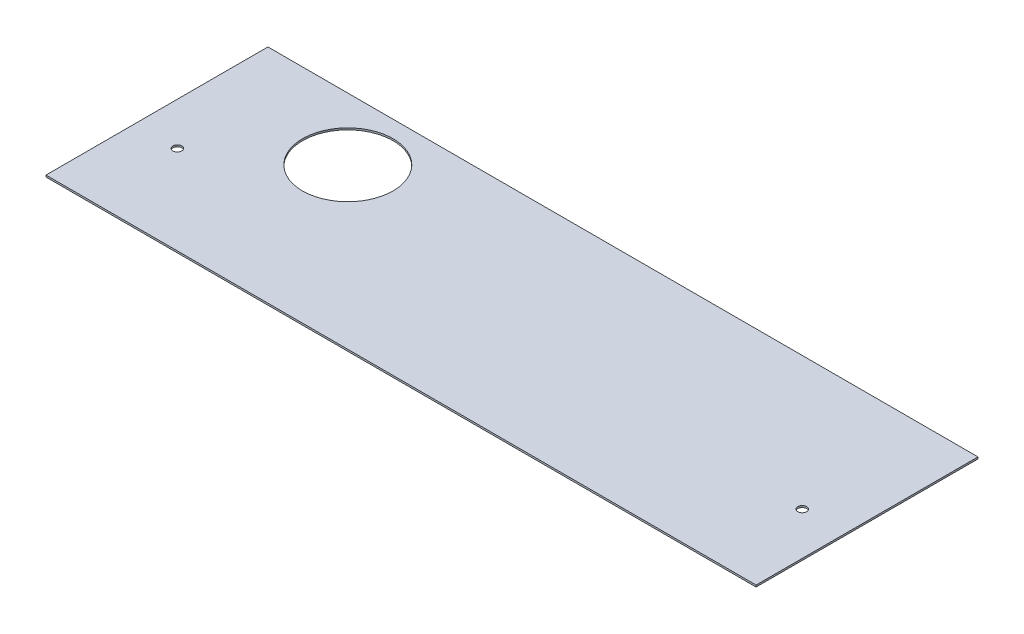
from build123d import *

# Parameters (mm, degrees)
SKETCH_2_W             = 400
SKETCH_2_H             = 125
SKETCH_2_R             = 2.5
SM_BASE_FLANGE_1_DEPTH = 1
SKETCH_3_R             = 25.5
CUT_EXTRUDE_1_DEPTH    = 420.077558454


# Sheet-metal steps are written as plain solids
with BuildPart() as part:
    # Sketch 2 → Базовая кромка1 (new body)
    with BuildSketch(Plane(origin=(0, 0, 0), x_dir=(1, 0, 0), z_dir=(0, 1, 0))):
        with Locations((200, 62.5)):
            Rectangle(SKETCH_2_W, SKETCH_2_H)
        with Locations(Location((24, 50, 0), (0, 0, 270))):
            Circle(SKETCH_2_R, mode=Mode.SUBTRACT)
        with Locations(Location((376, 50, 0), (0, 0, 90))):
            Circle(SKETCH_2_R, mode=Mode.SUBTRACT)
    extrude(amount=-SM_BASE_FLANGE_1_DEPTH)

    # Эскиз3 → Вырез-Вытянуть1 (cut, through all)
    with BuildSketch(Plane(origin=(0, 0, 0), x_dir=(1, 0, 0), z_dir=(0, 1, 0))):
        with Locations(Location((80, 90, 0), (0, 0, 270))):
            Circle(SKETCH_3_R)
    extrude(amount=-CUT_EXTRUDE_1_DEPTH, mode=Mode.SUBTRACT)


solid = part.part
